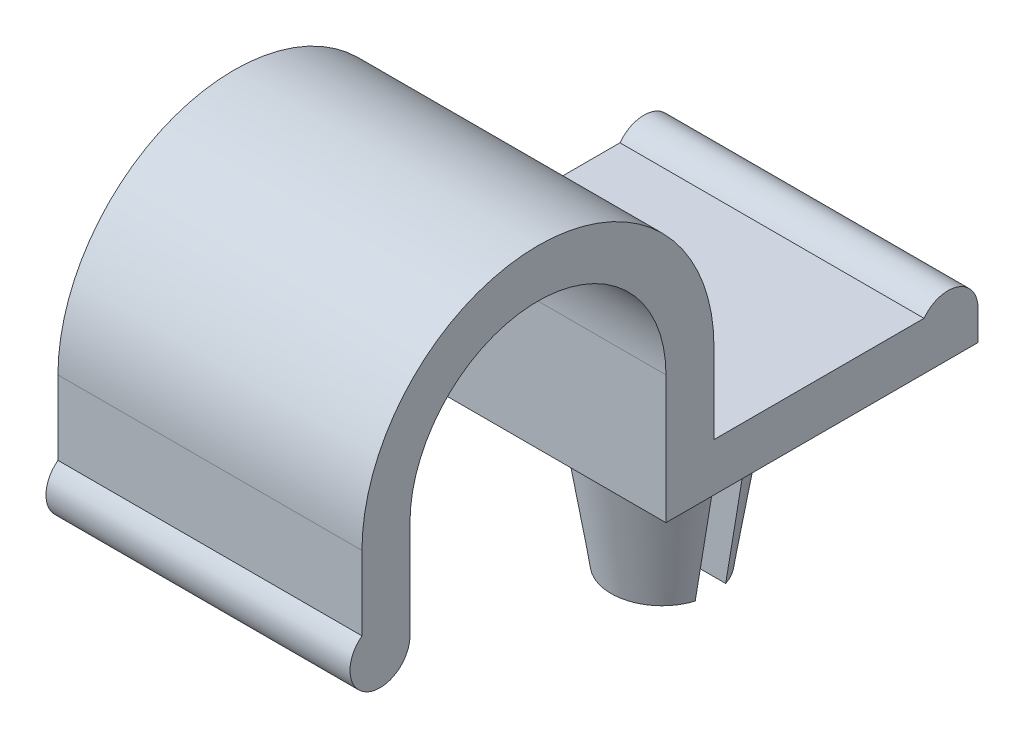
from build123d import *

# Parameters (mm, degrees)
BASE_EXTRUDE_DEPTH      = 3.8
CUT_EXTRUDE1_DEPTH      = 15.038454366
CUT_EXTRUDE1_DEPTH_BACK = 15.038454366


with BuildPart() as part:
    # Sketch1 → Base-Extrude (new, symmetric)
    with BuildSketch(Plane.ZY):
        with BuildLine():
            Line((-9.65, -2), (-4.4, -2))
            Line((-4.4, -2), (-4.4, 0))
            ThreePointArc((-4.4, 0), (0, 4.4), (4.4, 0))
            Line((4.4, 0), (4.4, -1.85))
            ThreePointArc((4.4, -1.85), (4.285410197, -3.120820393), (3.2, -2.45))
            Line((3.2, -2.45), (3.2, 0))
            ThreePointArc((3.2, 0), (0, 3.2), (-3.2, 0))
            Line((-3.2, 0), (-3.2, -3.2))
            Line((-3.2, -3.2), (-11, -3.2))
            Line((-11, -3.2), (-11, -2.45))
            ThreePointArc((-11, -2.45), (-10.487170825, -1.738487526), (-9.65, -2))
        make_face()
    extrude(amount=BASE_EXTRUDE_DEPTH, both=True)

    # Sketch4 → Boss-Revolve1 (revolve)
    with BuildSketch(Plane.ZY):
        Polygon((-6.9, -3.2), (-6.9, -7.851), (-5.63, -7.851), (-5.15, -4.851), (-5.4, -4.851), (-5.4, -3.2), align=None)
    revolve(axis=Axis((0, -3.2, -6.9), (0, 1, 0)))

    # Sketch5 → Cut-Extrude1 (cut, two sides: drawn at the far end of the back side and taken through both)
    with BuildSketch(Plane.ZY.offset(-CUT_EXTRUDE1_DEPTH_BACK)):
        with BuildLine():
            Line((-7.281, -7.851), (-6.519, -7.851))
            Line((-6.519, -7.851), (-6.519, -3.787))
            ThreePointArc((-6.519, -3.787), (-6.9, -3.406), (-7.281, -3.787))
            Line((-7.281, -3.787), (-7.281, -7.851))
        make_face()
    extrude(amount=CUT_EXTRUDE1_DEPTH + CUT_EXTRUDE1_DEPTH_BACK, mode=Mode.SUBTRACT)


solid = part.part
